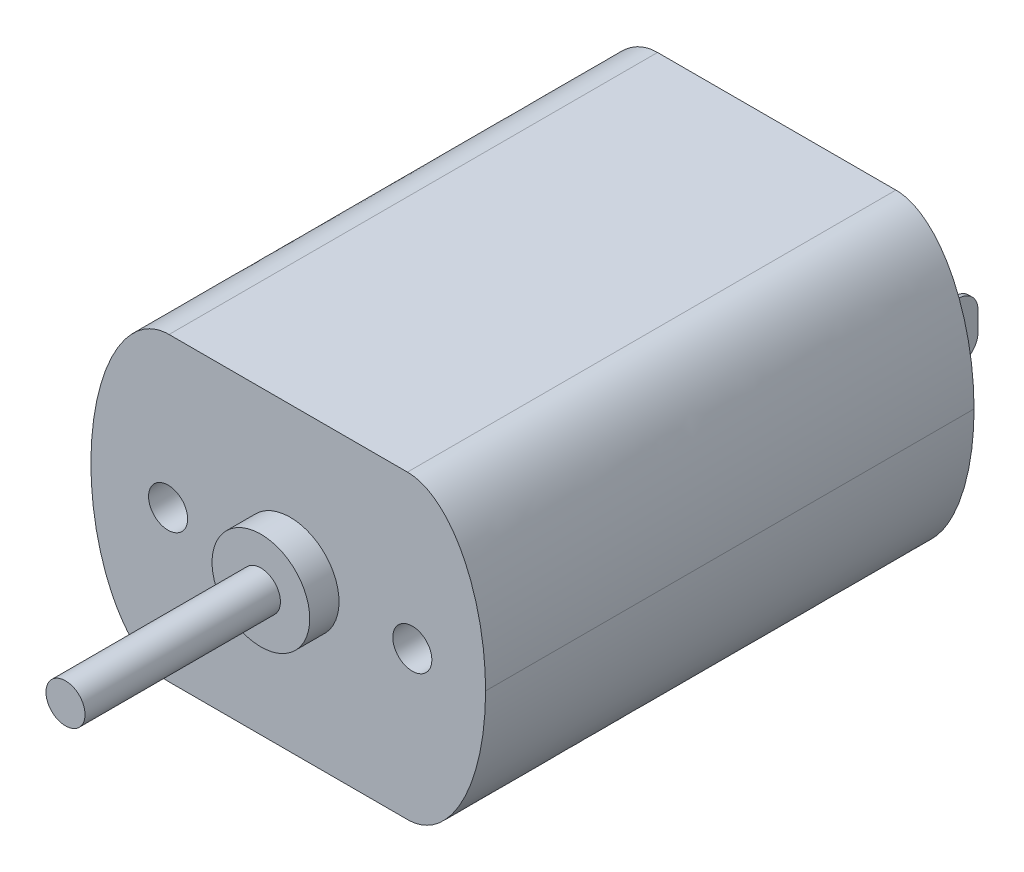
from build123d import *

# Parameters (mm, degrees)
SKETCH_1_W          = 20.2
SKETCH_1_H          = 15.4
EXTRUDE_1_DEPTH     = 25
SKETCH_2_R          = 2.5
EXTRUDE_2_DEPTH     = 1.5
SKETCH_3_R          = 1
EXTRUDE_3_DEPTH     = 10
FILLET_2_SIZE       = 7.7
FILLET_2_SIZE_2     = 4
FILLET_3_SIZE       = 4
FILLET_3_SIZE_2     = 7.7
SKETCH_4_R          = 1
CUT_EXTRUDE_1_DEPTH = 5
SKETCH_5_R          = 2.5
EXTRUDE_4_DEPTH     = 1.5
SKETCH_6_W          = 0.2
SKETCH_6_H          = 3
EXTRUDE_5_DEPTH     = 4
FILLET_4_R          = 1
SKETCH_7_R          = 0.3
CUT_EXTRUDE_2_DEPTH = 44.016597153


with BuildPart() as part:
    # 草图1 → 凸台-拉伸1 (new body)
    with BuildSketch(Plane.XY):
        with Locations((10.1, -7.7)):
            Rectangle(SKETCH_1_W, SKETCH_1_H)
    extrude(amount=EXTRUDE_1_DEPTH)

    # 草图2 → 凸台-拉伸2 (add)
    with BuildSketch(Plane.XY.offset(25)):
        with Locations((10.2, -7.5)):
            Circle(SKETCH_2_R)
    extrude(amount=EXTRUDE_2_DEPTH)

    # 草图3 → 凸台-拉伸3 (add)
    with BuildSketch(Plane.XY.offset(26.5)):
        with Locations((10.2, -7.5)):
            Circle(SKETCH_3_R)
    extrude(amount=EXTRUDE_3_DEPTH)

    # 圆角2
    # an asymmetric fillet: 7.7, 4 mm, written as the material it takes off along each edge
    with BuildSketch(Plane(origin=(20.2, -15.4, -19.25), x_dir=(0, 1, 0), z_dir=(0, 0, 1))) as fillet_2_piece_1:
        with BuildLine():
            Bezier((FILLET_2_SIZE, 0), (0, 0), (0, FILLET_2_SIZE_2), weights=[1, 0.707106781, 1])
            Line((0, FILLET_2_SIZE_2), (0, 0))
            Line((0, 0), (FILLET_2_SIZE, 0))
        make_face()
    extrude(amount=63.5, mode=Mode.SUBTRACT)
    with BuildSketch(Plane(origin=(0, 0, -19.25), x_dir=(1, 0, 0), z_dir=(0, 0, 1))) as fillet_2_piece_2:
        with BuildLine():
            Bezier((FILLET_2_SIZE_2, 0), (0, 0), (0, -FILLET_2_SIZE), weights=[1, 0.707106781, 1])
            Line((0, -FILLET_2_SIZE), (0, 0))
            Line((0, 0), (FILLET_2_SIZE_2, 0))
        make_face()
    extrude(amount=63.5, mode=Mode.SUBTRACT)

    # 圆角3
    # an asymmetric fillet: 7.7, 4 mm, written as the material it takes off along each edge
    with BuildSketch(Plane(origin=(20.2, 0, -19.25), x_dir=(-1, 0, 0), z_dir=(0, 0, 1)), Plane(origin=(0, -15.4, -19.25), x_dir=(1, 0, 0), z_dir=(0, 0, 1))) as fillet_3_piece_1:
        with BuildLine():
            Bezier((FILLET_3_SIZE, 0), (0, 0), (0, FILLET_3_SIZE_2), weights=[1, 0.707106781, 1])
            Line((0, FILLET_3_SIZE_2), (0, 0))
            Line((0, 0), (FILLET_3_SIZE, 0))
        make_face()
    extrude(amount=63.5, mode=Mode.SUBTRACT)

    # 草图4 → 切除-拉伸1 (cut)
    with BuildSketch(Plane.XY.offset(25)):
        with Locations((3.95, -7.7)):
            Circle(SKETCH_4_R)
        with Locations((16.45, -7.7)):
            Circle(SKETCH_4_R)
    extrude(amount=-CUT_EXTRUDE_1_DEPTH, mode=Mode.SUBTRACT)

    # 草图5 → 凸台-拉伸4 (add)
    with BuildSketch(Plane(origin=(0, 0, 0), x_dir=(-1, 0, 0), z_dir=(0, 0, -1))):
        with Locations(Location((-10.1, -7.7, 0), (0, 0, 180))):
            Circle(SKETCH_5_R)
    extrude(amount=EXTRUDE_4_DEPTH)

    # 草图6 → 凸台-拉伸5 (add)
    with BuildSketch(Plane(origin=(0, 0, 0), x_dir=(-1, 0, 0), z_dir=(0, 0, -1))):
        with Locations((-3.536419709, -7.7)):
            Rectangle(SKETCH_6_W, SKETCH_6_H)
        with Locations((-16.302368295, -7.7)):
            Rectangle(SKETCH_6_W, SKETCH_6_H)
    extrude(amount=EXTRUDE_5_DEPTH)

    # 圆角4
    fillet_4_edges = [part.edges().sort_by_distance(p)[0] for p in [
        (3.536419709, -6.2, -4),
        (3.536419709, -9.2, -4),
        (16.302368295, -6.2, -4),
        (16.302368295, -9.2, -4),
    ]]
    fillet(fillet_4_edges, radius=FILLET_4_R)

    # 草图7 → 切除-拉伸2 (cut, through all)
    with BuildSketch(Plane.ZY.offset(-3.436419709)):
        with Locations((-3, -7.7)):
            Circle(SKETCH_7_R)
    extrude(amount=-CUT_EXTRUDE_2_DEPTH, mode=Mode.SUBTRACT)


solid = part.part
